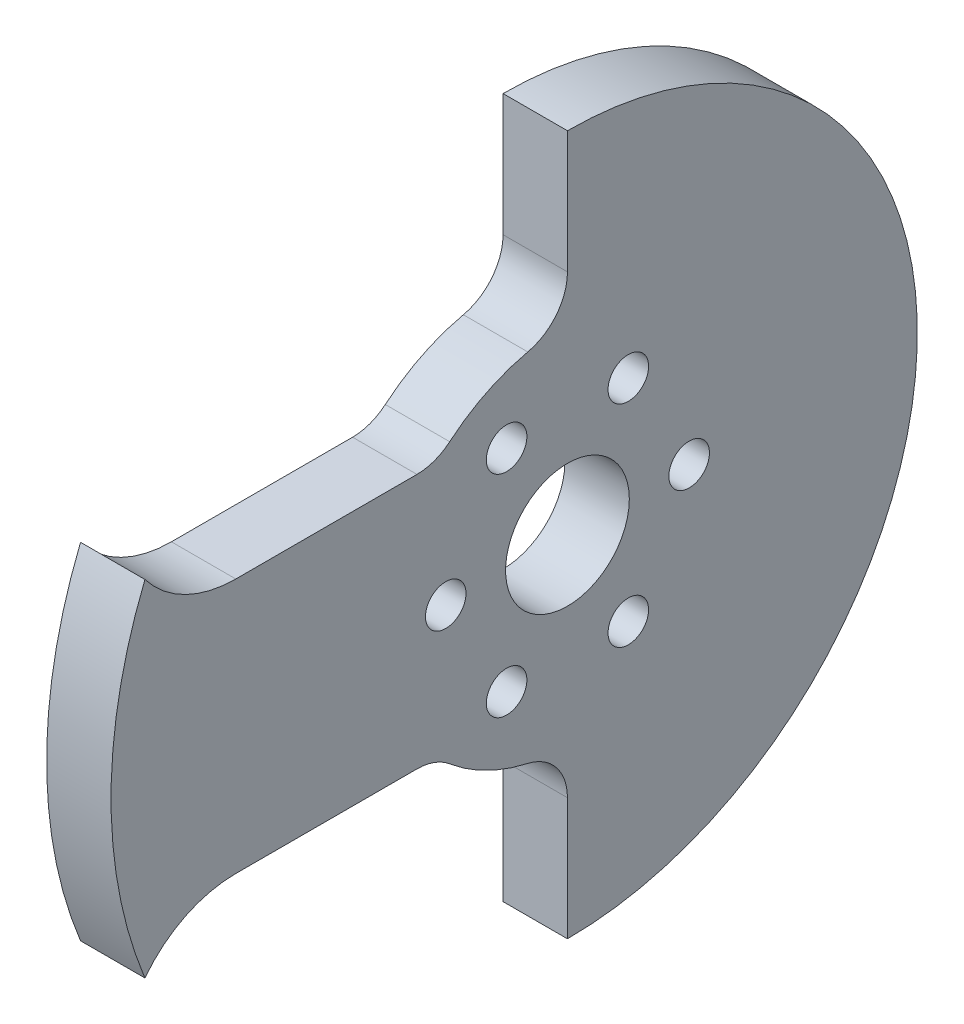
from build123d import *

# Parameters (mm, degrees)
BOSS_EXTRUDE1_DEPTH      = 3.175
BOSS_EXTRUDE1_DEPTH_BACK = 3.175
SKETCH1_R                = 6.1
SKETCH1_R_2              = 2


with BuildPart() as part:
    # Sketch1 → Boss-Extrude1 (new, two sides: drawn at the far end of the back side and taken through both)
    with BuildSketch(Plane(origin=(0, 0, 0), x_dir=(0, 0, -1), z_dir=(1, 0, 0)).offset(-BOSS_EXTRUDE1_DEPTH_BACK)):
        with BuildLine():
            Line((-0.089909589, 64.015198307), (-0.028642334, 63.936164622))
            ThreePointArc((-0.028642334, 63.936164622), (3.915206527, 60.723907078), (8.870259996, 59.575))
            Line((8.870259996, 59.575), (26.732798823, 59.575))
            ThreePointArc((26.732798823, 59.575), (28.449880523, 59.879083643), (29.95810764, 60.754347826))
            ThreePointArc((29.95810764, 60.754347826), (33.576176367, 63.127965258), (37.656175903, 64.569521642))
            ThreePointArc((37.656175903, 64.569521642), (40.47016687, 66.32222811), (41.569219382, 69.449944321))
            Line((41.569219382, 69.449944321), (41.569219382, 81.5))
            ThreePointArc((41.569219382, 81.5), (76.069219382, 47), (41.569219382, 12.5))
            Line((41.569219382, 12.5), (41.569219382, 24.550055679))
            ThreePointArc((41.569219382, 24.550055679), (40.47016687, 27.67777189), (37.656175903, 29.430478358))
            ThreePointArc((37.656175903, 29.430478358), (33.576176367, 30.872034742), (29.95810764, 33.245652174))
            ThreePointArc((29.95810764, 33.245652174), (28.449880523, 34.120916357), (26.732798823, 34.425))
            Line((26.732798823, 34.425), (8.870259996, 34.425))
            ThreePointArc((8.870259996, 34.425), (3.915206527, 33.276092922), (-0.028642334, 30.063835378))
            Line((-0.028642334, 30.063835378), (-0.089909589, 29.984801693))
            ThreePointArc((-0.089909589, 29.984801693), (-3.430780618, 47), (-0.089909589, 64.015198307))
        make_face()
        with Locations((41.569219382, 47)):
            Circle(SKETCH1_R, mode=Mode.SUBTRACT)
        with Locations((47.569219382, 57.392304845)):
            Circle(SKETCH1_R_2, mode=Mode.SUBTRACT)
        with Locations((35.569219382, 57.392304845)):
            Circle(SKETCH1_R_2, mode=Mode.SUBTRACT)
        with Locations((29.569219382, 47)):
            Circle(SKETCH1_R_2, mode=Mode.SUBTRACT)
        with Locations((35.569219382, 36.607695155)):
            Circle(SKETCH1_R_2, mode=Mode.SUBTRACT)
        with Locations((47.569219382, 36.607695155)):
            Circle(SKETCH1_R_2, mode=Mode.SUBTRACT)
        with Locations((53.569219382, 47)):
            Circle(SKETCH1_R_2, mode=Mode.SUBTRACT)
    extrude(amount=BOSS_EXTRUDE1_DEPTH + BOSS_EXTRUDE1_DEPTH_BACK)


solid = part.part
